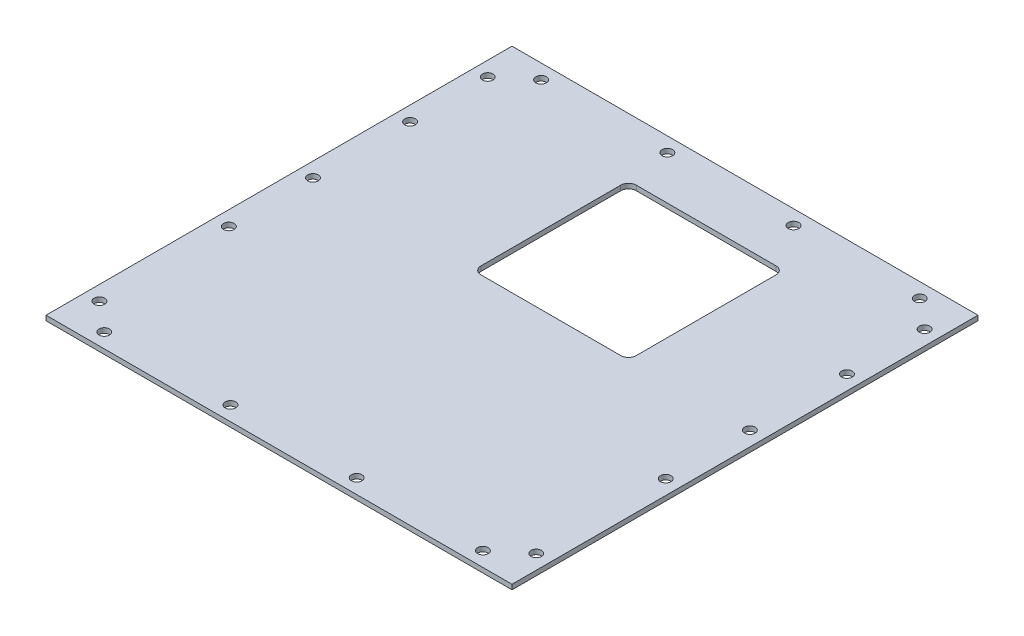
from build123d import *

# Parameters (mm, degrees)
SKETCH2_W                 = 152.4
SKETCH2_H                 = 152.4
BOSS_EXTRUDE1_DEPTH       = 1.5875
F_5_CLEARANCE_HOLE2_D     = 3.4544
F_5_CLEARANCE_HOLE3_D     = 3.4544
LPATTERN1_COUNT           = 4
LPATTERN1_PITCH           = 42.333333333
LPATTERN2_COUNT           = 4
LPATTERN2_PITCH           = 41.275
F_5_CLEARANCE_HOLE4_D     = 3.4544
F_5_CLEARANCE_HOLE4_DEPTH = 12.7
F_5_CLEARANCE_HOLE4_TIP   = 1.037806461
SKETCH12_W                = 50.8
SKETCH12_H                = 50.8
CUT_EXTRUDE1_DEPTH        = 2.54
FILLET2_R                 = 2.54


with BuildPart() as part:
    # Sketch2 → Boss-Extrude1 (new body)
    with BuildSketch(Plane(origin=(0, 0, 0), x_dir=(1, 0, 0), z_dir=(0, 1, 0))):
        with Locations((76.2, 76.2)):
            Rectangle(SKETCH2_W, SKETCH2_H)
    extrude(amount=BOSS_EXTRUDE1_DEPTH)

    # #5 Clearance Hole2 (through all)
    with Locations(Plane(origin=(0, 1.5875, 0), x_dir=(1, 0, 0), z_dir=(0, 1, 0))):
        with Locations((14.2875, 147.6375), (14.2875, 4.7625)):
            f_5_clearance_hole2 = Hole(F_5_CLEARANCE_HOLE2_D / 2)

    # #5 Clearance Hole3 (through all)
    with Locations(Plane(origin=(0, 1.5875, 0), x_dir=(1, 0, 0), z_dir=(0, 1, 0))):
        with Locations((4.7625, 139.7), (147.6375, 139.7)):
            f_5_clearance_hole3 = Hole(F_5_CLEARANCE_HOLE3_D / 2)

    # LPattern1: #5 Clearance Hole3 ×4, 1 skipped
    with Locations(*[(0, 0, i * LPATTERN1_PITCH) for i in range(1, LPATTERN1_COUNT) if i not in (1,)]):
        add(f_5_clearance_hole3, mode=Mode.SUBTRACT)

    # LPattern2: #5 Clearance Hole2 ×4
    with Locations(*[(i * LPATTERN2_PITCH, 0, 0) for i in range(1, LPATTERN2_COUNT)]):
        add(f_5_clearance_hole2, mode=Mode.SUBTRACT)

    # #5 Clearance Hole4
    with Locations(Plane(origin=(0, 1.5875, 0), x_dir=(1, 0, 0), z_dir=(0, 1, 0))):
        with Locations((147.6375, 114.3), (147.6375, 82.55), (4.7625, 82.55), (4.7625, 114.3)):
            Hole(F_5_CLEARANCE_HOLE4_D / 2, depth=F_5_CLEARANCE_HOLE4_DEPTH)
            with Locations((0, 0, -(F_5_CLEARANCE_HOLE4_DEPTH + F_5_CLEARANCE_HOLE4_TIP / 2))):  # 118° drill point
                Cone(0, F_5_CLEARANCE_HOLE4_D / 2, F_5_CLEARANCE_HOLE4_TIP, mode=Mode.SUBTRACT)

    # Sketch12 → Cut-Extrude1 (cut)
    with BuildSketch(Plane(origin=(0, 1.5875, 0), x_dir=(1, 0, 0), z_dir=(0, 1, 0))):
        with Locations((82.55, 107.95)):
            Rectangle(SKETCH12_W, SKETCH12_H)
    extrude(amount=-CUT_EXTRUDE1_DEPTH, mode=Mode.SUBTRACT)

    # Fillet2
    fillet2_edges = [part.edges().sort_by_distance(p)[0] for p in [
        (107.95, 0.79375, -82.55),
        (57.15, 0.79375, -82.55),
        (57.15, 0.79375, -133.35),
        (107.95, 0.79375, -133.35),
    ]]
    fillet(fillet2_edges, radius=FILLET2_R)


solid = part.part
